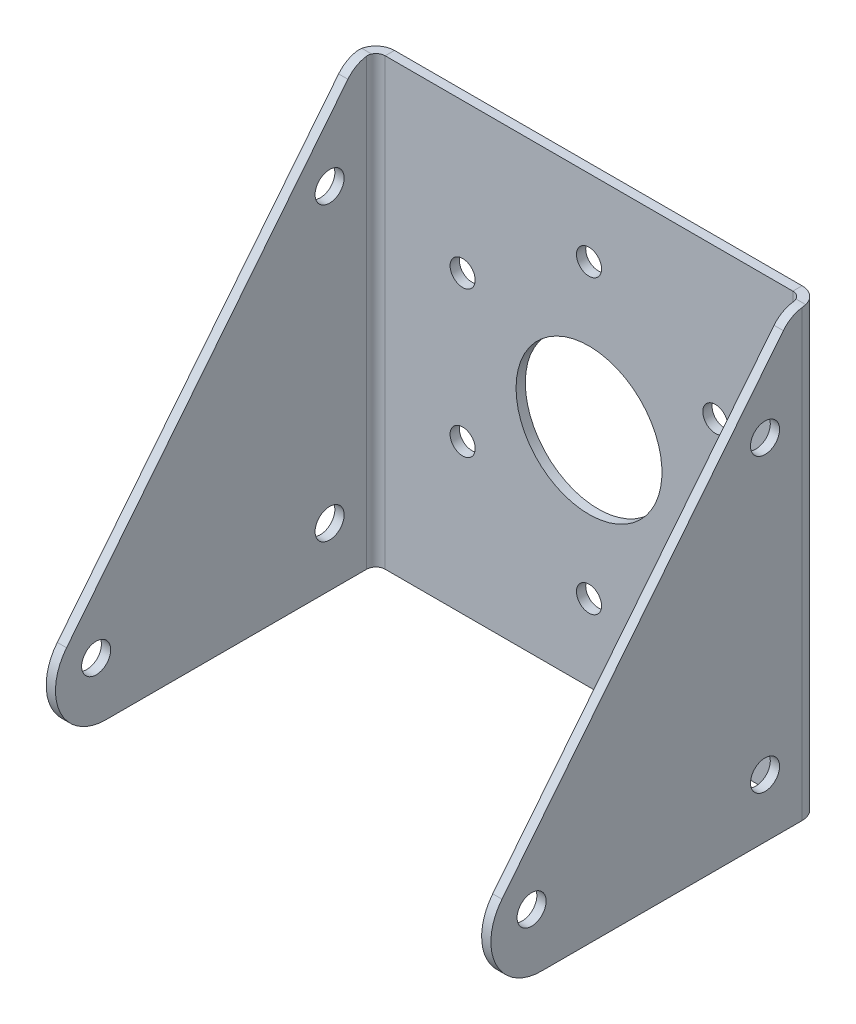
from build123d import *

# Parameters (mm, degrees)
SKETCH1_W                      = 76.2
SKETCH1_H                      = 76.2
BASE_FLANGE1_DEPTH             = 1.5875
EDGE_FLANGE1_STRIP_W           = 9.525
EDGE_FLANGE1_STRIP_H           = 1.5875
EDGE_FLANGE1_STRIP_CUT_DEPTH   = 76.2
EDGE_FLANGE1_STRIP_2_W         = 9.525
EDGE_FLANGE1_STRIP_2_H         = 1.5875
EDGE_FLANGE1_STRIP_CUT_2_DEPTH = 76.2
EDGE_FLANGE1_DEPTH             = 76.2
EDGE_FLANGE1_BEND_DEPTH        = 76.2
UOR23_ARM_2_P_002_START        = -73.139044615
UOR23_ARM_2_P_002_OUTLINE_R    = 2.4892
UOR23_ARM_2_P_002_OUTLINE_R_2  = 15.875
UOR23_ARM_2_P_002_OUTLINE_R_3  = 4.7625
UOR23_ARM_2_P_002_DEPTH        = 4.7625
BODY_MOVE_COPY2_ANGLE          = 90
SKETCH19_R                     = 2.4892
CUT_EXTRUDE1_DEPTH             = 116.786744303
CUT_EXTRUDE2_REACH             = 80.071
SKETCH21_R                     = 12.5
M4_CLEARANCE_HOLE1_D           = 4.3
CIRPATTERN1_COUNT              = 6
FILLET1_R                      = 5


with BuildPart() as part:
    # Base-Flange1: sheet metal written as solids
    # Sketch1 → Base-Flange1 (new body)
    with BuildSketch(Plane.XY):
        Rectangle(SKETCH1_W, SKETCH1_H)
    extrude(amount=-BASE_FLANGE1_DEPTH)

    # Edge-Flange1: sheet metal written as solids
    # Edge-Flange1 strip (on a plane across the edge) → Edge-Flange1 strip cut (cut)
    with BuildSketch(Plane(origin=(-38.1, 38.1, 0), x_dir=(1, 0, 0), z_dir=(0, -1, 0))):
        with Locations((-1.5875, -0.79375)):
            Rectangle(EDGE_FLANGE1_STRIP_W, EDGE_FLANGE1_STRIP_H)
    extrude(amount=EDGE_FLANGE1_STRIP_CUT_DEPTH, mode=Mode.SUBTRACT)

    # Edge-Flange1 strip 2 (on a plane across the edge) → Edge-Flange1 strip cut 2 (cut)
    with BuildSketch(Plane(origin=(38.1, -38.1, 0), x_dir=(-1, 0, 0), z_dir=(0, 1, 0))):
        with Locations((-1.5875, -0.79375)):
            Rectangle(EDGE_FLANGE1_STRIP_2_W, EDGE_FLANGE1_STRIP_2_H)
    extrude(amount=EDGE_FLANGE1_STRIP_CUT_2_DEPTH, mode=Mode.SUBTRACT)

    # Edge-Flange1 section (on a plane across the edge) → Edge-Flange1 (add)
    with BuildSketch(Plane(origin=(-38.1, 38.1, 0), x_dir=(1, 0, 0), z_dir=(0, -1, 0))):
        with BuildLine():
            Line((0, 1.5875), (0, 78.4125))
            Line((0, 78.4125), (1.5875, 78.4125))
            Line((1.5875, 78.4125), (1.5875, 1.5875))
            ThreePointArc((1.5875, 1.5875), (2.052467985, 0.464967985), (3.175, 0))
            Line((3.175, 0), (3.175, -1.5875))
            ThreePointArc((3.175, -1.5875), (0.92993597, -0.65756403), (0, 1.5875))
        make_face()
    extrude(amount=EDGE_FLANGE1_DEPTH)

    # Edge-Flange1 section 2 (on a plane across the edge) → Edge-Flange1 bend (add)
    with BuildSketch(Plane(origin=(38.1, -38.1, 0), x_dir=(-1, 0, 0), z_dir=(0, 1, 0))):
        with BuildLine():
            Line((0, 1.5875), (0, 78.4125))
            Line((0, 78.4125), (1.5875, 78.4125))
            Line((1.5875, 78.4125), (1.5875, 1.5875))
            ThreePointArc((1.5875, 1.5875), (2.052467985, 0.464967985), (3.175, 0))
            Line((3.175, 0), (3.175, -1.5875))
            ThreePointArc((3.175, -1.5875), (0.92993597, -0.65756403), (0, 1.5875))
        make_face()
    extrude(amount=EDGE_FLANGE1_BEND_DEPTH)

    # Sketch19 → Cut-Extrude1 (cut, through all)
    with BuildSketch(Plane.ZY.offset(38.1)):
        with Locations((47.9375, -28.1)):
            Circle(SKETCH19_R)
        with Locations((7.9375, -28.1)):
            Circle(SKETCH19_R)
        with Locations((7.9375, 21.9)):
            Circle(SKETCH19_R)
        with BuildLine():
            Line((44.814024762, -13.790579067), (23.287818675, 13.117178542))
            Line((23.287818675, 13.117178542), (3.301561509, 38.1))
            Line((3.301561509, 38.1), (78.4125, 38.1))
            Line((78.4125, 38.1), (78.4125, -38.1))
            Line((78.4125, -38.1), (62.182318934, -38.1))
            Line((62.182318934, -38.1), (46.255313034, -38.1))
            ThreePointArc((46.255313034, -38.1), (54.055416951, -33.194673329), (53.013147261, -24.039482191))
            Line((53.013147261, -24.039482191), (44.814024762, -13.790579067))
        make_face()
    extrude(amount=-CUT_EXTRUDE1_DEPTH, mode=Mode.SUBTRACT)

    # Sketch21 → Cut-Extrude2 (cut, up to next)
    with BuildSketch(Plane(origin=(0, 0, -1.5875), x_dir=(-1, 0, 0), z_dir=(0, 0, -1)), mode=Mode.PRIVATE) as cut_extrude2_sk1:
        Circle(SKETCH21_R)
    cut_extrude2_tool1 = extrude(cut_extrude2_sk1.sketch, amount=-CUT_EXTRUDE2_REACH, mode=Mode.PRIVATE) & part.part
    add(cut_extrude2_tool1.solids().sort_by_distance((0, 0, -1.5875))[0], mode=Mode.SUBTRACT)

    # M4 Clearance Hole1 (through all)
    with Locations(Plane(origin=(0, 0, -1.5875), x_dir=(-1, 0, 0), z_dir=(0, 0, -1))):
        with Locations((0, 25)):
            m4_clearance_hole1 = Hole(M4_CLEARANCE_HOLE1_D / 2)

    # CirPattern1: M4 Clearance Hole1 ×6 about axis
    cirpattern1_axis = Axis((0, 0, 0), (0, 0, 1))
    for i in range(1, CIRPATTERN1_COUNT):
        add(m4_clearance_hole1.rotate(cirpattern1_axis, i * 360 / CIRPATTERN1_COUNT), mode=Mode.SUBTRACT)

    # Fillet1
    fillet1_edges = [part.edges().sort_by_distance(p)[0] for p in [
        (-37.30625, 38.1, 3.301561509),
        (37.30625, 38.1, 3.301561509),
    ]]
    fillet(fillet1_edges, radius=FILLET1_R)


with BuildPart() as body_2:
    # UOR23-ARM-2-P-002: read off the stored shape, not the designer's step
    # UOR23-ARM-2-P-002 outline → UOR23-ARM-2-P-002 (new body)
    with BuildSketch(Plane.XY.offset(UOR23_ARM_2_P_002_START)):
        with BuildLine():
            Line((-606.620760236, 28.959751689), (-512.767628332, 6.9035095))
            ThreePointArc((-512.767628332, 6.9035095), (-508.790869183, 6.208113422), (-504.760487237, 5.97528215))
            Line((-504.760487237, 5.97528215), (-79.760487237, 5.97528215))
            Line((-79.760487237, 5.97528215), (-79.760487237, 75.97528215))
            Line((-79.760487237, 75.97528215), (-504.760487237, 75.97528215))
            ThreePointArc((-504.760487237, 75.97528215), (-507.955084638, 75.829185051), (-511.123012244, 75.392113432))
            Line((-511.123012244, 75.392113432), (-605.926632805, 57.866083751))
            ThreePointArc((-605.926632805, 57.866083751), (-618.009121698, 43.694720355), (-606.620760236, 28.959751689))
        make_face()
        with Locations((-446.110487237, 15.97528215)):
            Circle(UOR23_ARM_2_P_002_OUTLINE_R, mode=Mode.SUBTRACT)
        with Locations((-366.110487237, 15.97528215)):
            Circle(UOR23_ARM_2_P_002_OUTLINE_R, mode=Mode.SUBTRACT)
        with Locations((-504.760487237, 40.97528215)):
            Circle(UOR23_ARM_2_P_002_OUTLINE_R_2, mode=Mode.SUBTRACT)
        with BuildLine():
            Line((-430.760168562, 24.758103607), (-409.233962474, 51.665861217))
            ThreePointArc((-409.233962474, 51.665861217), (-406.110487236, 53.167081026), (-402.987011999, 51.665861217))
            Line((-402.987011999, 51.665861217), (-381.460805912, 24.758103607))
            ThreePointArc((-381.460805912, 24.758103607), (-380.979068204, 20.526568495), (-384.584281149, 18.259323417))
            Line((-384.584281149, 18.259323417), (-427.636693324, 18.259323417))
            ThreePointArc((-427.636693324, 18.259323417), (-431.241906269, 20.526568495), (-430.760168562, 24.758103607))
        make_face(mode=Mode.SUBTRACT)
        with Locations((-286.110487237, 15.97528215)):
            Circle(UOR23_ARM_2_P_002_OUTLINE_R, mode=Mode.SUBTRACT)
        with Locations((-206.110487237, 15.97528215)):
            Circle(UOR23_ARM_2_P_002_OUTLINE_R, mode=Mode.SUBTRACT)
        with Locations((-126.110487237, 15.97528215)):
            Circle(UOR23_ARM_2_P_002_OUTLINE_R, mode=Mode.SUBTRACT)
        with Locations((-86.110487237, 15.97528215)):
            Circle(UOR23_ARM_2_P_002_OUTLINE_R, mode=Mode.SUBTRACT)
        with BuildLine():
            Line((-350.760168562, 24.758103607), (-329.233962474, 51.665861217))
            ThreePointArc((-329.233962474, 51.665861217), (-326.110487236, 53.167081026), (-322.987011999, 51.665861217))
            Line((-322.987011999, 51.665861217), (-301.460805912, 24.758103607))
            ThreePointArc((-301.460805912, 24.758103607), (-300.979068204, 20.526568495), (-304.584281149, 18.259323417))
            Line((-304.584281149, 18.259323417), (-347.636693324, 18.259323417))
            ThreePointArc((-347.636693324, 18.259323417), (-351.241906269, 20.526568495), (-350.760168562, 24.758103607))
        make_face(mode=Mode.SUBTRACT)
        with BuildLine():
            Line((-270.760168562, 24.758103607), (-249.233962474, 51.665861217))
            ThreePointArc((-249.233962474, 51.665861217), (-246.110487237, 53.167081026), (-242.987011999, 51.665861217))
            Line((-242.987011999, 51.665861217), (-221.460805912, 24.758103607))
            ThreePointArc((-221.460805912, 24.758103607), (-220.979068204, 20.526568495), (-224.584281149, 18.259323417))
            Line((-224.584281149, 18.259323417), (-267.636693324, 18.259323417))
            ThreePointArc((-267.636693324, 18.259323417), (-271.241906269, 20.526568495), (-270.760168562, 24.758103607))
        make_face(mode=Mode.SUBTRACT)
        with BuildLine():
            Line((-190.760168562, 24.758103607), (-169.233962474, 51.665861217))
            ThreePointArc((-169.233962474, 51.665861217), (-166.110487237, 53.167081026), (-162.987011999, 51.665861217))
            Line((-162.987011999, 51.665861217), (-141.460805912, 24.758103607))
            ThreePointArc((-141.460805912, 24.758103607), (-140.979068204, 20.526568495), (-144.584281149, 18.259323417))
            Line((-144.584281149, 18.259323417), (-187.636693324, 18.259323417))
            ThreePointArc((-187.636693324, 18.259323417), (-191.241906269, 20.526568495), (-190.760168562, 24.758103607))
        make_face(mode=Mode.SUBTRACT)
        with Locations((-603.241262538, 43.340099916)):
            Circle(UOR23_ARM_2_P_002_OUTLINE_R_3, mode=Mode.SUBTRACT)
        with BuildLine():
            ThreePointArc((-442.987011999, 30.284703083), (-446.110487236, 28.783483273), (-449.233962474, 30.284703083))
            Line((-449.233962474, 30.284703083), (-470.760168562, 57.192460692))
            ThreePointArc((-470.760168562, 57.192460692), (-471.241906269, 61.423995804), (-467.636693324, 63.691240882))
            Line((-467.636693324, 63.691240882), (-424.584281149, 63.691240882))
            ThreePointArc((-424.584281149, 63.691240882), (-420.979068204, 61.423995804), (-421.460805912, 57.192460692))
            Line((-421.460805912, 57.192460692), (-442.987011999, 30.284703083))
        make_face(mode=Mode.SUBTRACT)
        with BuildLine():
            ThreePointArc((-362.987011999, 30.284703083), (-366.110487236, 28.783483273), (-369.233962474, 30.284703083))
            Line((-369.233962474, 30.284703083), (-390.760168562, 57.192460692))
            ThreePointArc((-390.760168562, 57.192460692), (-391.241906269, 61.423995804), (-387.636693324, 63.691240882))
            Line((-387.636693324, 63.691240882), (-344.584281149, 63.691240882))
            ThreePointArc((-344.584281149, 63.691240882), (-340.979068204, 61.423995804), (-341.460805912, 57.192460692))
            Line((-341.460805912, 57.192460692), (-362.987011999, 30.284703083))
        make_face(mode=Mode.SUBTRACT)
        with Locations((-406.110487237, 65.97528215)):
            Circle(UOR23_ARM_2_P_002_OUTLINE_R, mode=Mode.SUBTRACT)
        with BuildLine():
            ThreePointArc((-282.987011999, 30.284703083), (-286.110487236, 28.783483273), (-289.233962474, 30.284703083))
            Line((-289.233962474, 30.284703083), (-310.760168562, 57.192460692))
            ThreePointArc((-310.760168562, 57.192460692), (-311.241906269, 61.423995804), (-307.636693324, 63.691240882))
            Line((-307.636693324, 63.691240882), (-264.584281149, 63.691240882))
            ThreePointArc((-264.584281149, 63.691240882), (-260.979068204, 61.423995804), (-261.460805912, 57.192460692))
            Line((-261.460805912, 57.192460692), (-282.987011999, 30.284703083))
        make_face(mode=Mode.SUBTRACT)
        with BuildLine():
            ThreePointArc((-202.987011999, 30.284703083), (-206.110487237, 28.783483273), (-209.233962474, 30.284703083))
            Line((-209.233962474, 30.284703083), (-230.760168562, 57.192460692))
            ThreePointArc((-230.760168562, 57.192460692), (-231.241906269, 61.423995804), (-227.636693324, 63.691240882))
            Line((-227.636693324, 63.691240882), (-184.584281149, 63.691240882))
            ThreePointArc((-184.584281149, 63.691240882), (-180.979068204, 61.423995804), (-181.460805912, 57.192460692))
            Line((-181.460805912, 57.192460692), (-202.987011999, 30.284703083))
        make_face(mode=Mode.SUBTRACT)
        with BuildLine():
            ThreePointArc((-122.987011999, 30.284703083), (-126.110487237, 28.783483273), (-129.233962474, 30.284703083))
            Line((-129.233962474, 30.284703083), (-150.760168562, 57.192460692))
            ThreePointArc((-150.760168562, 57.192460692), (-151.241906269, 61.423995804), (-147.636693324, 63.691240882))
            Line((-147.636693324, 63.691240882), (-104.584281149, 63.691240882))
            ThreePointArc((-104.584281149, 63.691240882), (-100.979068204, 61.423995804), (-101.460805912, 57.192460692))
            Line((-101.460805912, 57.192460692), (-122.987011999, 30.284703083))
        make_face(mode=Mode.SUBTRACT)
        with Locations((-326.110487237, 65.97528215)):
            Circle(UOR23_ARM_2_P_002_OUTLINE_R, mode=Mode.SUBTRACT)
        with Locations((-246.110487237, 65.97528215)):
            Circle(UOR23_ARM_2_P_002_OUTLINE_R, mode=Mode.SUBTRACT)
        with Locations((-166.110487237, 65.97528215)):
            Circle(UOR23_ARM_2_P_002_OUTLINE_R, mode=Mode.SUBTRACT)
        with Locations((-86.110487237, 65.97528215)):
            Circle(UOR23_ARM_2_P_002_OUTLINE_R, mode=Mode.SUBTRACT)
    extrude(amount=UOR23_ARM_2_P_002_DEPTH)


with BuildPart() as body_2_1:
    # Body-Move/Copy2: read off the stored shape, not the designer's step
    # Body-Move/Copy2: moved
    add(body_2.part.moved(Location((78.1729872, -44.0752821, 30.2765446))).rotate(Axis((0, 0, 0), (0, 1, 0)), BODY_MOVE_COPY2_ANGLE))


solid = part.part
